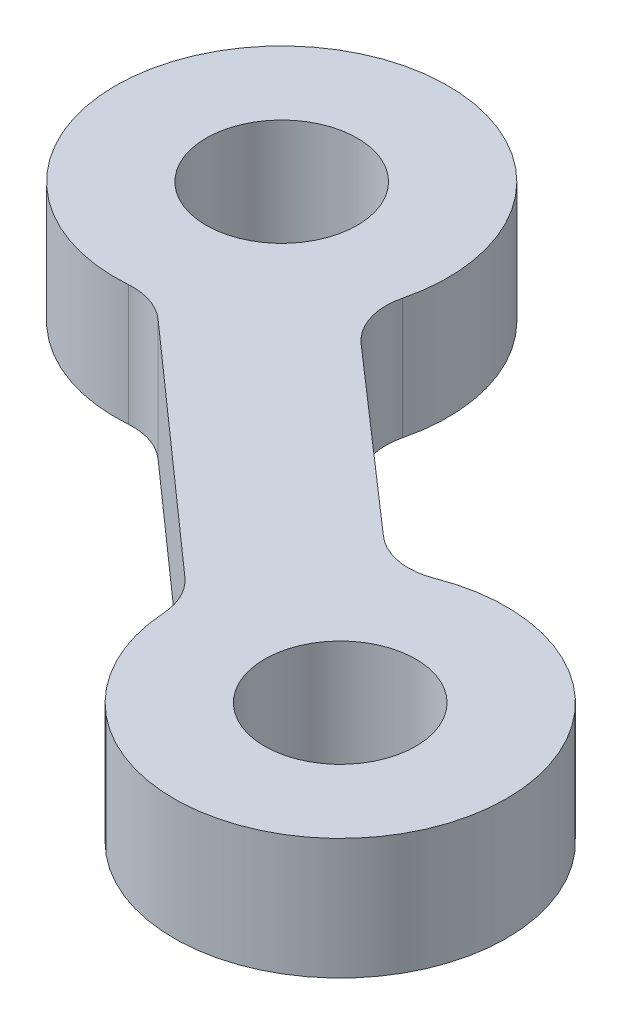
from build123d import *

# Parameters (mm, degrees)
SKETCH2_R           = 2.5
BOSS_EXTRUDE1_DEPTH = 4
FILLET1_R           = 2


with BuildPart() as part:
    # Sketch2 → Boss-Extrude1 (new body)
    with BuildSketch(Plane(origin=(0, 0, 0), x_dir=(1, 0, 0), z_dir=(0, 1, 0))):
        with BuildLine():
            ThreePointArc((92.503166469, 34.006299468), (102.726842439, 30.793598232), (94.955116322, 38.172302232))
            Line((94.955116322, 38.172302232), (87.02771465, 45.104892713))
            ThreePointArc((87.02771465, 45.104892713), (78.69699813, 51.863103241), (83.294746555, 42.171098459))
            Line((83.294746555, 42.171098459), (92.503166469, 34.006299468))
        make_face()
        with Locations((97.986880619, 33.583358427)):
            Circle(SKETCH2_R, mode=Mode.SUBTRACT)
        with Locations((82.095552315, 47.538773298)):
            Circle(SKETCH2_R, mode=Mode.SUBTRACT)
    extrude(amount=BOSS_EXTRUDE1_DEPTH)

    # Fillet1
    fillet1_edges = [part.edges().sort_by_distance(p)[0] for p in [
        (83.294746555, 2, -42.171098459),
        (92.503166469, 2, -34.006299468),
        (87.02771465, 2, -45.104892713),
        (94.955116322, 2, -38.172302232),
    ]]
    fillet(fillet1_edges, radius=FILLET1_R)


solid = part.part
